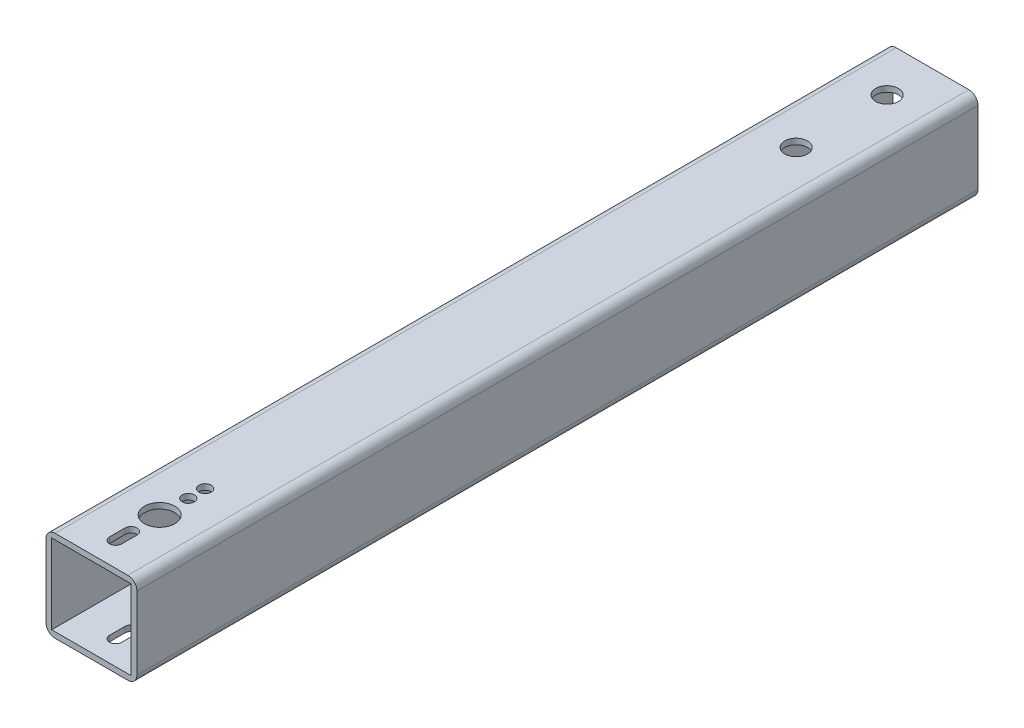
from build123d import *

# Parameters (mm, degrees)
SKETCH1_W               = 25.4
SKETCH1_H               = 25.4
SKETCH1_W_2             = 22.225
SKETCH1_H_2             = 22.225
BOSS_EXTRUDE1_DEPTH     = 234.95
FILLET1_R               = 2.54
SKETCH2_R               = 3.175
CUT_EXTRUDE1_DEPTH      = 238.560919126
CUT_EXTRUDE2_DEPTH      = 238.560919126
CUT_EXTRUDE2_DEPTH_BACK = 238.560919126
SKETCH3_R               = 1.7
SKETCH3_R_2             = 4.25


with BuildPart() as part:
    # Sketch1 → Boss-Extrude1 (new body)
    with BuildSketch(Plane.XY):
        with Locations((-11.559591837, -1.275183673)):
            Rectangle(SKETCH1_W, SKETCH1_H)
        with Locations((-11.559591837, -1.275183673)):
            Rectangle(SKETCH1_W_2, SKETCH1_H_2, mode=Mode.SUBTRACT)
    extrude(amount=BOSS_EXTRUDE1_DEPTH)

    # Fillet1
    fillet1_edges = [part.edges().sort_by_distance(p)[0] for p in [
        (1.140408163, -13.975183673, 117.475),
        (-24.259591837, -13.975183673, 117.475),
        (-24.259591837, 11.424816327, 117.475),
        (1.140408163, 11.424816327, 117.475),
    ]]
    fillet(fillet1_edges, radius=FILLET1_R)

    # Sketch2 → Cut-Extrude1 (cut, through all)
    with BuildSketch(Plane(origin=(0, 11.424816327, 0), x_dir=(1, 0, 0), z_dir=(0, 1, 0))):
        with Locations((-11.559591837, -12.7)):
            Circle(SKETCH2_R)
        with Locations((-11.559591837, -38.1)):
            Circle(SKETCH2_R)
    extrude(amount=-CUT_EXTRUDE1_DEPTH, mode=Mode.SUBTRACT)

    # Sketch3 → Cut-Extrude2 (cut, two sides: drawn at the far end of the back side and taken through both)
    with BuildSketch(Plane(origin=(0, 11.424816327, 0), x_dir=(1, 0, 0), z_dir=(0, 1, 0)).offset(-CUT_EXTRUDE2_DEPTH_BACK)):
        with Locations((-11.559591837, -207.9)):
            Circle(SKETCH3_R)
        with Locations((-11.559591837, -203.19501094)):
            Circle(SKETCH3_R)
        with Locations((-11.559591837, -215.9)):
            Circle(SKETCH3_R_2)
        with BuildLine():
            Line((-9.859591837, -223.9), (-9.859591837, -228.19501094))
            ThreePointArc((-9.859591837, -228.19501094), (-11.559591837, -229.89501094), (-13.259591837, -228.19501094))
            Line((-13.259591837, -228.19501094), (-13.259591837, -223.9))
            ThreePointArc((-13.259591837, -223.9), (-11.559591837, -222.2), (-9.859591837, -223.9))
        make_face()
    extrude(amount=CUT_EXTRUDE2_DEPTH + CUT_EXTRUDE2_DEPTH_BACK, mode=Mode.SUBTRACT)


solid = part.part
